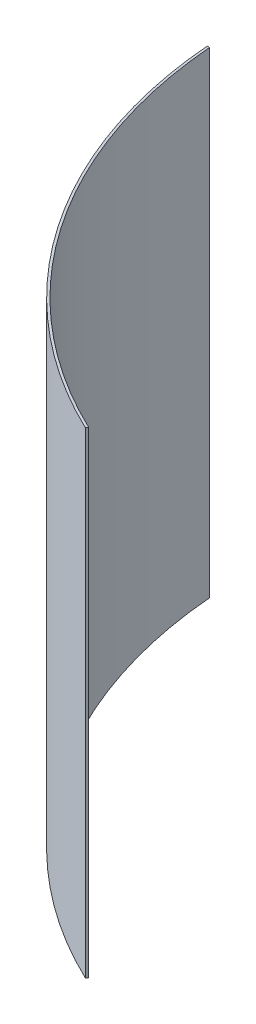
from build123d import *

# Parameters (mm, degrees)
BOSS_EXTRUDE1_DEPTH = 2025.87


with BuildPart() as part:
    # Sketch1 → Boss-Extrude1 (new body)
    with BuildSketch(Plane(origin=(0, 0, 0), x_dir=(1, 0, 0), z_dir=(0, 1, 0))):
        with BuildLine():
            Line((-861.952697058, -1815.802177561), (-868.327691046, -1823.8440232))
            ThreePointArc((-868.327691046, -1823.8440232), (-1663.915850855, -1145.331411109), (-2013.659102155, -159.928172345))
            Line((-2013.659102155, -159.928172345), (-2003.507162544, -161.428156267))
            ThreePointArc((-2003.507162544, -161.428156267), (-1654.374021293, -1141.554465486), (-861.952697058, -1815.802177561))
        make_face()
    extrude(amount=BOSS_EXTRUDE1_DEPTH)


solid = part.part
